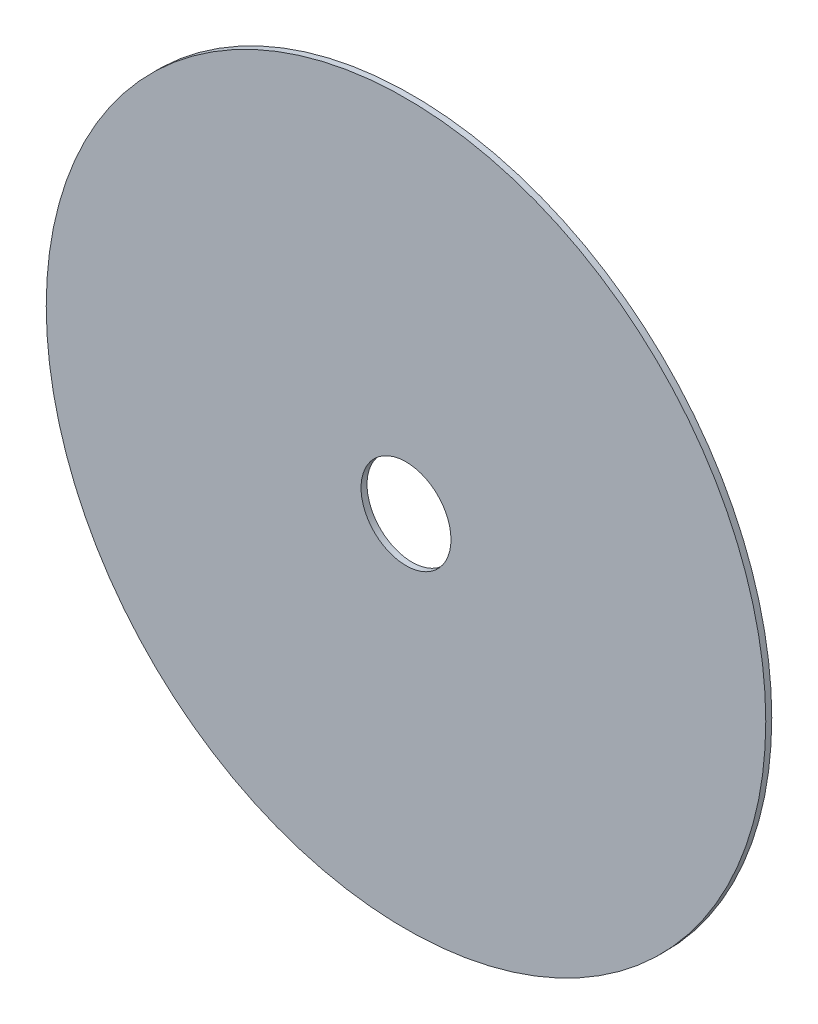
from build123d import *

# Parameters (mm, degrees)
ESQUISSE1_R        = 60
ESQUISSE1_R_2      = 7.5
BOSS_EXTRU_1_DEPTH = 1


with BuildPart() as part:
    # Esquisse1 → Boss.-Extru.1 (new body)
    with BuildSketch(Plane.XY):
        Circle(ESQUISSE1_R)
        Circle(ESQUISSE1_R_2, mode=Mode.SUBTRACT)
    extrude(amount=BOSS_EXTRU_1_DEPTH)


solid = part.part
